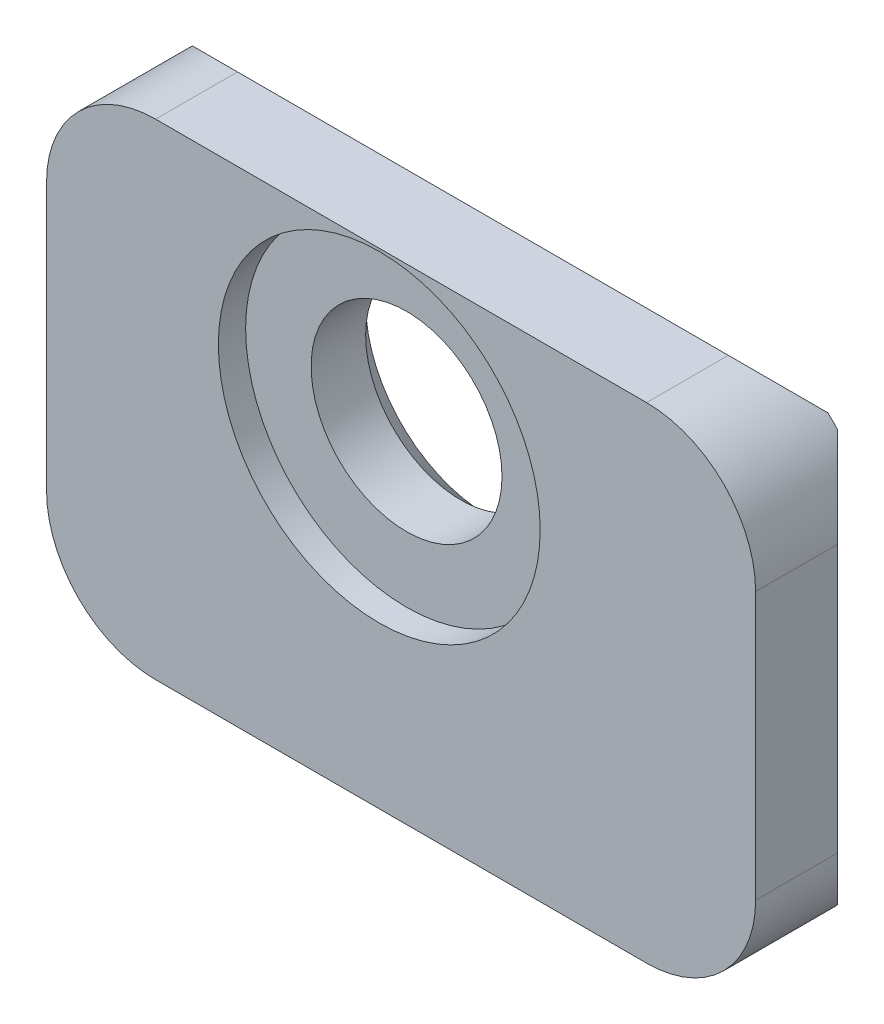
from build123d import *

# Parameters (mm, degrees)
SKETCH1_W           = 13
SKETCH1_H           = 8.9
BOSS_EXTRUDE1_DEPTH = 2
SKETCH2_R           = 1.75
CUT_EXTRUDE4_DEPTH  = 9.127268914
SKETCH3_R           = 2.95
CUT_EXTRUDE9_DEPTH  = 0.5
CHAMFER1_SIZE       = 0.5
FILLET2_R           = 2


with BuildPart() as part:
    # Sketch1 → Boss-Extrude1 (new body)
    with BuildSketch(Plane.XY):
        Rectangle(SKETCH1_W, SKETCH1_H)
    extrude(amount=BOSS_EXTRUDE1_DEPTH)

    # Sketch2 → Cut-Extrude4 (cut, through all)
    with BuildSketch(Plane.XY.offset(2)):
        with Locations((-0.4, 1.45)):
            Circle(SKETCH2_R)
    extrude(amount=-CUT_EXTRUDE4_DEPTH, mode=Mode.SUBTRACT)

    # Sketch3 → Cut-Extrude9 (cut)
    with BuildSketch(Plane.XY.offset(2)):
        with Locations((-0.4, 1.45)):
            Circle(SKETCH3_R)
    extrude(amount=-CUT_EXTRUDE9_DEPTH, mode=Mode.SUBTRACT)

    # Chamfer1
    chamfer1_edges = [part.edges().sort_by_distance(p)[0] for p in [
        (-2.15, 1.45, 0),
        (0, -4.45, 0),
        (-6.5, 0, 0),
        (0, 4.45, 0),
        (6.5, 0, 0),
    ]]
    chamfer(chamfer1_edges, length=CHAMFER1_SIZE)

    # Fillet2
    # the kernel refuses this fillet: 2 mm, written as the material it takes off along each edge
    with BuildSketch(Plane(origin=(-6.5, 4.45, -4.5), x_dir=(0, -1, 0), z_dir=(0, 0, 1)), Plane(origin=(-6.5, -4.45, -4.5), x_dir=(1, 0, 0), z_dir=(0, 0, 1))) as fillet2_piece_1:
        with BuildLine():
            CenterArc((FILLET2_R, FILLET2_R), FILLET2_R, 180, 90)
            Line((0, FILLET2_R), (0, 0))
            Line((0, 0), (FILLET2_R, 0))
        make_face()
    extrude(amount=11.5, mode=Mode.SUBTRACT)
    with BuildSketch(Plane(origin=(6.5, 4.45, -4.5), x_dir=(0, -1, 0), z_dir=(0, 0, 1)), Plane(origin=(6.5, -4.45, -4.5), x_dir=(-1, 0, 0), z_dir=(0, 0, 1))) as fillet2_piece_2:
        with BuildLine():
            CenterArc((FILLET2_R, -FILLET2_R), FILLET2_R, 90, 90)
            Line((0, -FILLET2_R), (0, 0))
            Line((0, 0), (FILLET2_R, 0))
        make_face()
    extrude(amount=11.5, mode=Mode.SUBTRACT)


solid = part.part
